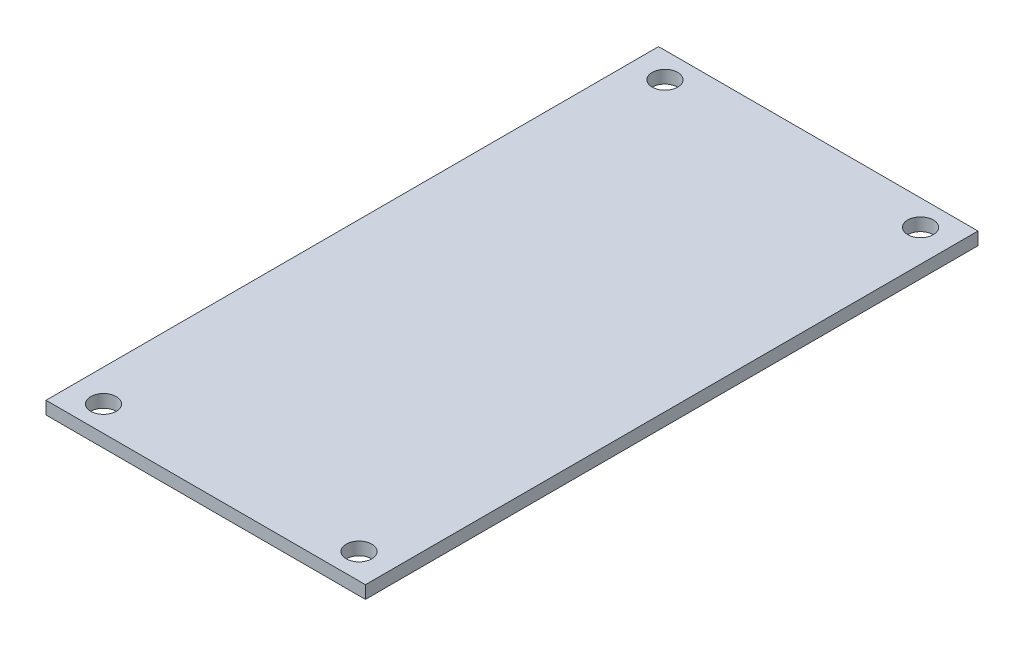
from build123d import *

# Parameters (mm, degrees)
SKETCH1_W           = 125
SKETCH1_H           = 239.7125
BOSS_EXTRUDE1_DEPTH = 5
CUT_EXTRUDE1_REACH  = 272.392
SKETCH2_R           = 5


with BuildPart() as part:
    # Sketch1 → Boss-Extrude1 (new body)
    with BuildSketch(Plane(origin=(0, 0, 0), x_dir=(1, 0, 0), z_dir=(0, 1, 0))):
        with Locations((62.5, -119.85625)):
            Rectangle(SKETCH1_W, SKETCH1_H)
    extrude(amount=BOSS_EXTRUDE1_DEPTH)

    # Sketch2 → Cut-Extrude1 (cut, up to next)
    with BuildSketch(Plane.XZ, mode=Mode.PRIVATE) as cut_extrude1_sk1:
        with Locations((12.5, 229.7125)):
            Circle(SKETCH2_R)
    cut_extrude1_tool1 = extrude(cut_extrude1_sk1.sketch, amount=-CUT_EXTRUDE1_REACH, mode=Mode.PRIVATE) & part.part
    # Sketch2 → Cut-Extrude1 (cut, up to next)
    with BuildSketch(Plane.XZ, mode=Mode.PRIVATE) as cut_extrude1_sk2:
        with Locations((112.5, 229.7125)):
            Circle(SKETCH2_R)
    cut_extrude1_tool2 = extrude(cut_extrude1_sk2.sketch, amount=-CUT_EXTRUDE1_REACH, mode=Mode.PRIVATE) & part.part
    # Sketch2 → Cut-Extrude1 (cut, up to next)
    with BuildSketch(Plane.XZ, mode=Mode.PRIVATE) as cut_extrude1_sk3:
        with Locations((12.5, 10)):
            Circle(SKETCH2_R)
    cut_extrude1_tool3 = extrude(cut_extrude1_sk3.sketch, amount=-CUT_EXTRUDE1_REACH, mode=Mode.PRIVATE) & part.part
    # Sketch2 → Cut-Extrude1 (cut, up to next)
    with BuildSketch(Plane.XZ, mode=Mode.PRIVATE) as cut_extrude1_sk4:
        with Locations((112.5, 10)):
            Circle(SKETCH2_R)
    cut_extrude1_tool4 = extrude(cut_extrude1_sk4.sketch, amount=-CUT_EXTRUDE1_REACH, mode=Mode.PRIVATE) & part.part
    add(cut_extrude1_tool1.solids().sort_by_distance((12.5, 0, 229.7125))[0], mode=Mode.SUBTRACT)
    add(cut_extrude1_tool2.solids().sort_by_distance((112.5, 0, 229.7125))[0], mode=Mode.SUBTRACT)
    add(cut_extrude1_tool3.solids().sort_by_distance((12.5, 0, 10))[0], mode=Mode.SUBTRACT)
    add(cut_extrude1_tool4.solids().sort_by_distance((112.5, 0, 10))[0], mode=Mode.SUBTRACT)


solid = part.part
